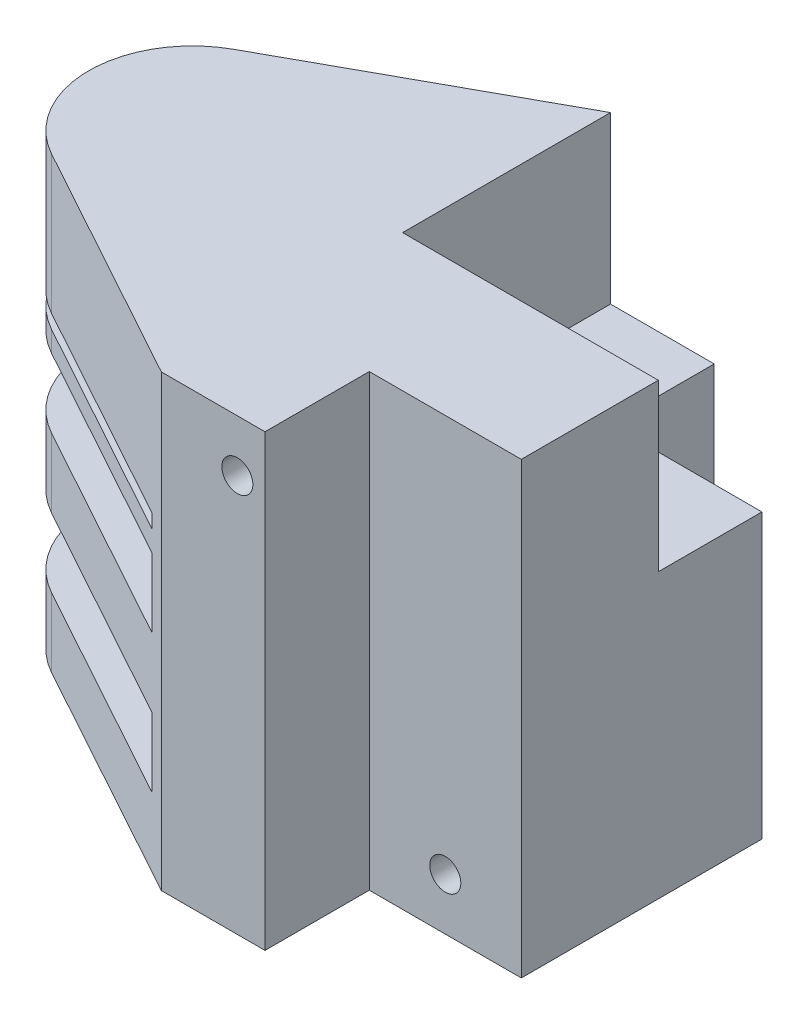
from build123d import *

# Parameters (mm, degrees)
SKETCH1_W               = 80
SKETCH1_H               = 65
BOSS_EXTRUDE1_DEPTH     = 65
SKETCH3_W               = 22
SKETCH3_H               = 15.09
CUT_EXTRUDE1_DEPTH      = 65.72
CUT_EXTRUDE2_DEPTH      = 20
CUT_EXTRUDE2_DEPTH_BACK = 55.72
SKETCH4_R               = 2.24505
SKETCH4_R_2             = 2.245
SKETCH5_W               = 65
SKETCH5_H               = 10
SKETCH5_H_2             = 2
CUT_EXTRUDE3_DEPTH      = 40
SKETCH23_W              = 37
SKETCH23_H              = 30.09
CUT_EXTRUDE15_DEPTH     = 24
CUT_EXTRUDE4_DEPTH      = 65
SKETCH10_R              = 1
CUT_EXTRUDE6_DEPTH      = 42


with BuildPart() as part:
    # Sketch1 → Boss-Extrude1 (new body)
    with BuildSketch(Plane.XY):
        with Locations((40, 32.5)):
            Rectangle(SKETCH1_W, SKETCH1_H)
    extrude(amount=BOSS_EXTRUDE1_DEPTH)

    # Sketch3 → Cut-Extrude1 (cut)
    with BuildSketch(Plane.XZ):
        with Locations((69, 57.455)):
            Rectangle(SKETCH3_W, SKETCH3_H)
        with Locations((69, 7.545)):
            Rectangle(SKETCH3_W, SKETCH3_H)
    extrude(amount=-CUT_EXTRUDE1_DEPTH, mode=Mode.SUBTRACT)

    # Sketch4 → Cut-Extrude2 (cut, two sides: drawn at the far end of the back side and taken through both)
    with BuildSketch(Plane.XY.offset(49.91).offset(-CUT_EXTRUDE2_DEPTH_BACK)):
        with Locations((69, 7.5)):
            Circle(SKETCH4_R)
        with Locations((54, 57.5)):
            Circle(SKETCH4_R_2)
    extrude(amount=CUT_EXTRUDE2_DEPTH + CUT_EXTRUDE2_DEPTH_BACK, mode=Mode.SUBTRACT)

    # Sketch5 → Cut-Extrude3 (cut)
    with BuildSketch(Plane.ZY):
        with Locations((32.5, 15)):
            Rectangle(SKETCH5_W, SKETCH5_H)
        with Locations((32.5, 35)):
            Rectangle(SKETCH5_W, SKETCH5_H)
        with Locations((32.5, 44)):
            Rectangle(SKETCH5_W, SKETCH5_H_2)
    extrude(amount=-CUT_EXTRUDE3_DEPTH, mode=Mode.SUBTRACT)

    # Sketch23 → Cut-Extrude15 (cut)
    with BuildSketch(Plane(origin=(0, 65, 0), x_dir=(1, 0, 0), z_dir=(0, 1, 0))):
        with Locations((61.5, -15.045)):
            Rectangle(SKETCH23_W, SKETCH23_H)
    extrude(amount=-CUT_EXTRUDE15_DEPTH, mode=Mode.SUBTRACT)

    # Sketch6 → Cut-Extrude4 (cut)
    with BuildSketch(Plane.XZ):
        with BuildLine():
            Line((0, 0), (43, 0))
            Line((43, 0), (7.776682895, 19.353757571))
            ThreePointArc((7.776682895, 19.353757571), (2.089737482, 24.862911437), (0, 32.5))
            Line((0, 32.5), (0, 0))
        make_face()
        with BuildLine():
            Line((0, 65), (0, 32.5))
            ThreePointArc((0, 32.5), (2.089737482, 40.137088563), (7.776682895, 45.646242429))
            Line((7.776682895, 45.646242429), (43, 65))
            Line((43, 65), (0, 65))
        make_face()
    extrude(amount=-CUT_EXTRUDE4_DEPTH, mode=Mode.SUBTRACT)

    # Sketch10 → Cut-Extrude6 (cut)
    with BuildSketch(Plane.XZ):
        with Locations((15, 32.5)):
            Circle(SKETCH10_R)
    extrude(amount=-CUT_EXTRUDE6_DEPTH, mode=Mode.SUBTRACT)


solid = part.part
